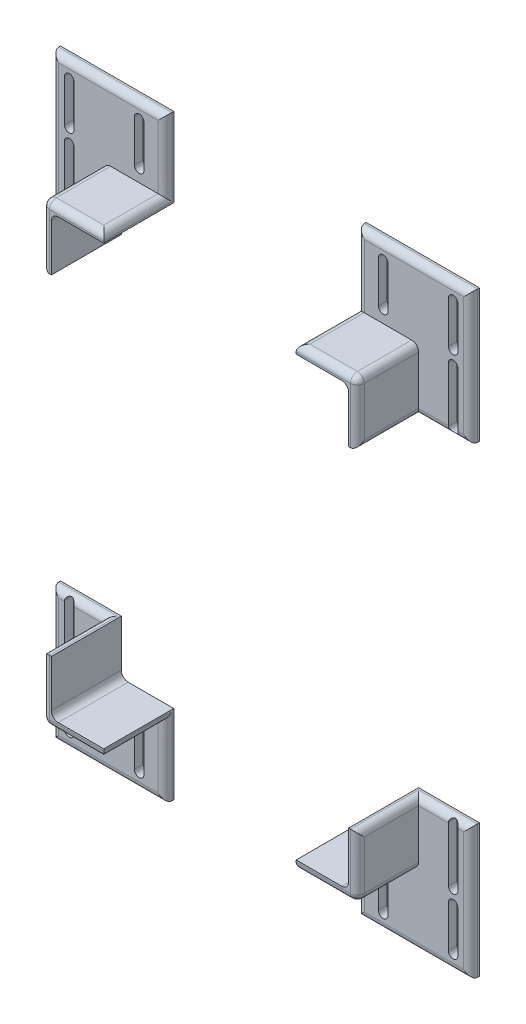
from build123d import *

# Parameters (mm, degrees)
SKETCH1_W           = 44.15
SKETCH1_H           = 39.080904613
BOSS_EXTRUDE1_DEPTH = 6.35
SKETCH2_W           = 6.35
SKETCH2_H           = 39.080904613
BOSS_EXTRUDE2_DEPTH = 44.45
SKETCH3_W           = 38.1
SKETCH3_H           = 57.454812193
BOSS_EXTRUDE3_DEPTH = 6.35
SKETCH4_W           = 38.1
SKETCH4_H           = 6.35
BOSS_EXTRUDE4_DEPTH = 44.45
SKETCH5_W           = 6.35
SKETCH5_H           = 6.35
BOSS_EXTRUDE5_DEPTH = 50.8
BOSS_EXTRUDE6_DEPTH = 6.35
CUT_EXTRUDE1_DEPTH  = 6.35
FILLET1_R           = 5
MIRROR1_ANGLE       = 180


with BuildPart() as part:
    # Sketch1 → Boss-Extrude1 (new body)
    with BuildSketch(Plane.XY):
        with Locations((-11.415800507, 255.775852307)):
            Rectangle(SKETCH1_W, SKETCH1_H)
    extrude(amount=BOSS_EXTRUDE1_DEPTH)

    # Sketch2 → Boss-Extrude2 (add)
    with BuildSketch(Plane.XY.offset(6.35)):
        with Locations((-30.315800507, 255.775852307)):
            Rectangle(SKETCH2_W, SKETCH2_H)
    extrude(amount=BOSS_EXTRUDE2_DEPTH)



with BuildPart() as body_2:
    # Sketch3 → Boss-Extrude3 (new body)
    with BuildSketch(Plane.XY):
        with Locations((-52.540800507, 207.507993904)):
            Rectangle(SKETCH3_W, SKETCH3_H)
    extrude(amount=BOSS_EXTRUDE3_DEPTH)

    # Sketch4 → Boss-Extrude4 (add)
    with BuildSketch(Plane.XY.offset(6.35)):
        with Locations((-52.540800507, 233.0604)):
            Rectangle(SKETCH4_W, SKETCH4_H)
    extrude(amount=BOSS_EXTRUDE4_DEPTH)


with BuildPart() as part_1:
    add(part.part)

    add(body_2.part)  # Boss-Extrude5 merges body 2
    # Sketch5 → Boss-Extrude5 (add)
    with BuildSketch(Plane.XY):
        with Locations((-30.315800507, 233.0604)):
            Rectangle(SKETCH5_W, SKETCH5_H)
    extrude(amount=BOSS_EXTRUDE5_DEPTH)

    # Sketch6 → Boss-Extrude6 (add)
    with BuildSketch(Plane.XY):
        Polygon((10.659199493, 236.2354), (-27.140800507, 236.2354), (-27.140800507, 229.8854), (-33.490800507, 229.8854), (-33.490800507, 178.780587807), (-27.140800507, 178.780587807), (10.659199493, 178.780587807), align=None)
    extrude(amount=BOSS_EXTRUDE6_DEPTH)

    # Sketch7 → Cut-Extrude1 (cut)
    with BuildSketch(Plane(origin=(0, 0, 0), x_dir=(-1, 0, 0), z_dir=(0, 0, -1))):
        with BuildLine():
            Line((49.411800507, 189.997729521), (49.411800507, 220.503129521))
            ThreePointArc((49.411800507, 220.503129521), (52.840800507, 223.932129521), (56.269800507, 220.503129521))
            Line((56.269800507, 220.503129521), (56.269800507, 189.997729521))
            ThreePointArc((56.269800507, 189.997729521), (52.840800507, 186.568729521), (49.411800507, 189.997729521))
        make_face()
        with BuildLine():
            Line((-1.388199493, 189.997729521), (-1.388199493, 220.503129521))
            ThreePointArc((-1.388199493, 220.503129521), (2.040800507, 223.932129521), (5.469800507, 220.503129521))
            Line((5.469800507, 220.503129521), (5.469800507, 189.997729521))
            ThreePointArc((5.469800507, 189.997729521), (2.040800507, 186.568729521), (-1.388199493, 189.997729521))
        make_face()
        with BuildLine():
            Line((-1.388199493, 230.803466193), (-1.388199493, 270.69844284))
            ThreePointArc((-1.388199493, 270.69844284), (2.040800507, 274.12744284), (5.469800507, 270.69844284))
            Line((5.469800507, 270.69844284), (5.469800507, 230.803466193))
            ThreePointArc((5.469800507, 230.803466193), (2.040800507, 227.374466193), (-1.388199493, 230.803466193))
        make_face()
    extrude(amount=-CUT_EXTRUDE1_DEPTH, mode=Mode.SUBTRACT)

    # Fillet1
    # the kernel refuses this fillet: 5 mm, written as the material it adds along each edge
    with BuildSketch(Plane(origin=(-33.490800507, 236.2354, 50.8), x_dir=(-1, 0, 0), z_dir=(0, 0, -1))) as fillet1_piece_1:
        with BuildLine():
            CenterArc((FILLET1_R, FILLET1_R), FILLET1_R, 180, 90)
            Line((0, FILLET1_R), (0, 0))
            Line((0, 0), (FILLET1_R, 0))
        make_face()
    extrude(amount=50.8)
    # the kernel refuses this fillet: 5 mm, written as the material it takes off along each edge
    with BuildSketch(Plane(origin=(-32.140800507, 234.8854, 45.8), x_dir=(0, -1, 0), z_dir=(0, 0, 1))) as fillet1_2_piece_1_section:
        Polygon((0, 0), (FILLET1_R, 0), (FILLET1_R, FILLET1_R), (0, FILLET1_R), align=None)
    fillet1_2_piece_1 = extrude(amount=FILLET1_R, mode=Mode.PRIVATE)
    fillet1_2_piece_1 = fillet1_2_piece_1 - Plane(origin=(-32.140800507, 234.8854, 45.8), x_dir=(-0.7071067811865475, 0.7071067811865475, 0), z_dir=(0, 0, 1)) * Sphere(FILLET1_R, mode=Mode.PRIVATE)
    add(fillet1_2_piece_1, mode=Mode.SUBTRACT)
    with BuildSketch(Plane(origin=(-84.090800507, 229.8854, 50.8), x_dir=(0, 1, 0), z_dir=(1, 0, 0))) as fillet1_2_piece_2:
        with BuildLine():
            CenterArc((FILLET1_R, -FILLET1_R), FILLET1_R, 90, 90)
            Line((0, -FILLET1_R), (0, 0))
            Line((0, 0), (FILLET1_R, 0))
        make_face()
    extrude(amount=51.95, mode=Mode.SUBTRACT)
    with BuildSketch(Plane(origin=(-27.140800507, 234.8854, 50.8), x_dir=(-1, 0, 0), z_dir=(0, 1, 0))) as fillet1_2_piece_3:
        with BuildLine():
            CenterArc((FILLET1_R, -FILLET1_R), FILLET1_R, 90, 90)
            Line((0, -FILLET1_R), (0, 0))
            Line((0, 0), (FILLET1_R, 0))
        make_face()
    extrude(amount=52.930904613, mode=Mode.SUBTRACT)
    with BuildSketch(Plane(origin=(-27.140800507, 275.316304613, 6.35), x_dir=(-1, 0, 0), z_dir=(0, 0, 1))) as fillet1_2_piece_4:
        with BuildLine():
            CenterArc((FILLET1_R, FILLET1_R), FILLET1_R, 180, 90)
            Line((0, FILLET1_R), (0, 0))
            Line((0, 0), (FILLET1_R, 0))
        make_face()
    extrude(amount=56.95, mode=Mode.SUBTRACT)
    with BuildSketch(Plane(origin=(-27.140800507, 275.316304613, 6.35), x_dir=(0, 0, -1), z_dir=(1, 0, 0))) as fillet1_2_piece_5:
        with BuildLine():
            CenterArc((FILLET1_R, -FILLET1_R), FILLET1_R, 90, 90)
            Line((0, -FILLET1_R), (0, 0))
            Line((0, 0), (FILLET1_R, 0))
        make_face()
    extrude(amount=50.3, mode=Mode.SUBTRACT)
    with BuildSketch(Plane(origin=(-27.140800507, 229.8854, 6.35), x_dir=(-1, 0, 0), z_dir=(0, 0, 1))) as fillet1_2_piece_6:
        with BuildLine():
            CenterArc((FILLET1_R, -FILLET1_R), FILLET1_R, 90, 90)
            Line((0, -FILLET1_R), (0, 0))
            Line((0, 0), (FILLET1_R, 0))
        make_face()
    extrude(amount=39.45, mode=Mode.SUBTRACT)
    with BuildSketch(Plane(origin=(10.659199493, 166.280587807, 6.35), x_dir=(0, 0, -1), z_dir=(0, 1, 0))) as fillet1_2_piece_7:
        with BuildLine():
            CenterArc((FILLET1_R, FILLET1_R), FILLET1_R, 180, 90)
            Line((0, FILLET1_R), (0, 0))
            Line((0, 0), (FILLET1_R, 0))
        make_face()
    extrude(amount=121.535716806, mode=Mode.SUBTRACT)
    with BuildSketch(Plane(origin=(-84.090800507, 178.780587807, 6.35), x_dir=(0, 0, -1), z_dir=(1, 0, 0))) as fillet1_2_piece_8:
        with BuildLine():
            CenterArc((FILLET1_R, FILLET1_R), FILLET1_R, 180, 90)
            Line((0, FILLET1_R), (0, 0))
            Line((0, 0), (FILLET1_R, 0))
        make_face()
    extrude(amount=107.25, mode=Mode.SUBTRACT)
    with BuildSketch(Plane(origin=(-71.590800507, 229.8854, 6.35), x_dir=(0, 1, 0), z_dir=(0, 0, 1))) as fillet1_2_piece_9:
        with BuildLine():
            CenterArc((FILLET1_R, -FILLET1_R), FILLET1_R, 90, 90)
            Line((0, -FILLET1_R), (0, 0))
            Line((0, 0), (FILLET1_R, 0))
        make_face()
    extrude(amount=56.95, mode=Mode.SUBTRACT)
    with BuildSketch(Plane(origin=(-71.590800507, 229.8854, 6.35), x_dir=(0, 0, -1), z_dir=(0, -1, 0))) as fillet1_2_piece_10:
        with BuildLine():
            CenterArc((FILLET1_R, FILLET1_R), FILLET1_R, 180, 90)
            Line((0, FILLET1_R), (0, 0))
            Line((0, 0), (FILLET1_R, 0))
        make_face()
    extrude(amount=63.604812193, mode=Mode.SUBTRACT)
    with BuildSketch(Plane(origin=(-27.140800507, 275.316304613, -6.15), x_dir=(-1, 0, 0), z_dir=(0, 0, 1))) as fillet1_2_piece_11a_section:
        with BuildLine():
            CenterArc((FILLET1_R, FILLET1_R), FILLET1_R, 180, 90)
            Line((0, FILLET1_R), (0, 0))
            Line((0, 0), (FILLET1_R, 0))
        make_face()
    fillet1_2_piece_11a = extrude(amount=69.45, mode=Mode.PRIVATE)
    fillet1_2_piece_11a = split(fillet1_2_piece_11a, bisect_by=Plane(origin=(-27.140800507, 275.316304613, 6.35), z_dir=(0, 0, -1)), keep=Keep.TOP, mode=Mode.PRIVATE)
    with BuildSketch(Plane(origin=(-39.640800507, 275.316304613, 6.35), x_dir=(0, 0, -1), z_dir=(1, 0, 0))) as fillet1_2_piece_11b_section:
        with BuildLine():
            CenterArc((FILLET1_R, -FILLET1_R), FILLET1_R, 90, 90)
            Line((0, -FILLET1_R), (0, 0))
            Line((0, 0), (FILLET1_R, 0))
        make_face()
    fillet1_2_piece_11b = extrude(amount=62.8, mode=Mode.PRIVATE)
    fillet1_2_piece_11b = split(fillet1_2_piece_11b, bisect_by=Plane(origin=(-27.140800507, 275.316304613, 6.35), z_dir=(-1, 0, 0)), keep=Keep.TOP, mode=Mode.PRIVATE)
    fillet1_2_piece_11 = fillet1_2_piece_11a & fillet1_2_piece_11b
    add(fillet1_2_piece_11, mode=Mode.SUBTRACT)
    with BuildSketch(Plane(origin=(-71.590800507, 229.8854, -6.15), x_dir=(0, 1, 0), z_dir=(0, 0, 1))) as fillet1_2_piece_12a_section:
        with BuildLine():
            CenterArc((FILLET1_R, -FILLET1_R), FILLET1_R, 90, 90)
            Line((0, -FILLET1_R), (0, 0))
            Line((0, 0), (FILLET1_R, 0))
        make_face()
    fillet1_2_piece_12a = extrude(amount=69.45, mode=Mode.PRIVATE)
    fillet1_2_piece_12a = split(fillet1_2_piece_12a, bisect_by=Plane(origin=(-71.590800507, 229.8854, 6.35), z_dir=(0, 0, -1)), keep=Keep.TOP, mode=Mode.PRIVATE)
    with BuildSketch(Plane(origin=(-71.590800507, 242.3854, 6.35), x_dir=(0, 0, -1), z_dir=(0, -1, 0))) as fillet1_2_piece_12b_section:
        with BuildLine():
            CenterArc((FILLET1_R, FILLET1_R), FILLET1_R, 180, 90)
            Line((0, FILLET1_R), (0, 0))
            Line((0, 0), (FILLET1_R, 0))
        make_face()
    fillet1_2_piece_12b = extrude(amount=76.104812193, mode=Mode.PRIVATE)
    fillet1_2_piece_12b = split(fillet1_2_piece_12b, bisect_by=Plane(origin=(-71.590800507, 229.8854, 6.35), z_dir=(0, 1, 0)), keep=Keep.TOP, mode=Mode.PRIVATE)
    fillet1_2_piece_12 = fillet1_2_piece_12a & fillet1_2_piece_12b
    add(fillet1_2_piece_12, mode=Mode.SUBTRACT)


with BuildPart() as body_2_2:
    # Mirror1: read off the stored shape, not the designer's step
    # Mirror1: copy of part
    add(part_1.part.moved(Location((282.881601, -790.565, 0))).rotate(Axis((0, 0, 0), (0, 0, 1)), MIRROR1_ANGLE))


with BuildPart() as body_3:
    # Mirror1 2: mirrored copy
    add(part_1.part.mirror(Plane(origin=(0, 395.2825, 0), x_dir=(1, 0, 0), z_dir=(0, 1, 0))))


with BuildPart() as body_4:
    # Mirror1 3: mirrored copy
    add(part_1.part.mirror(Plane.YZ.offset(-141.440800507)))


solid = Compound([part_1.part, body_2_2.part, body_3.part, body_4.part])
